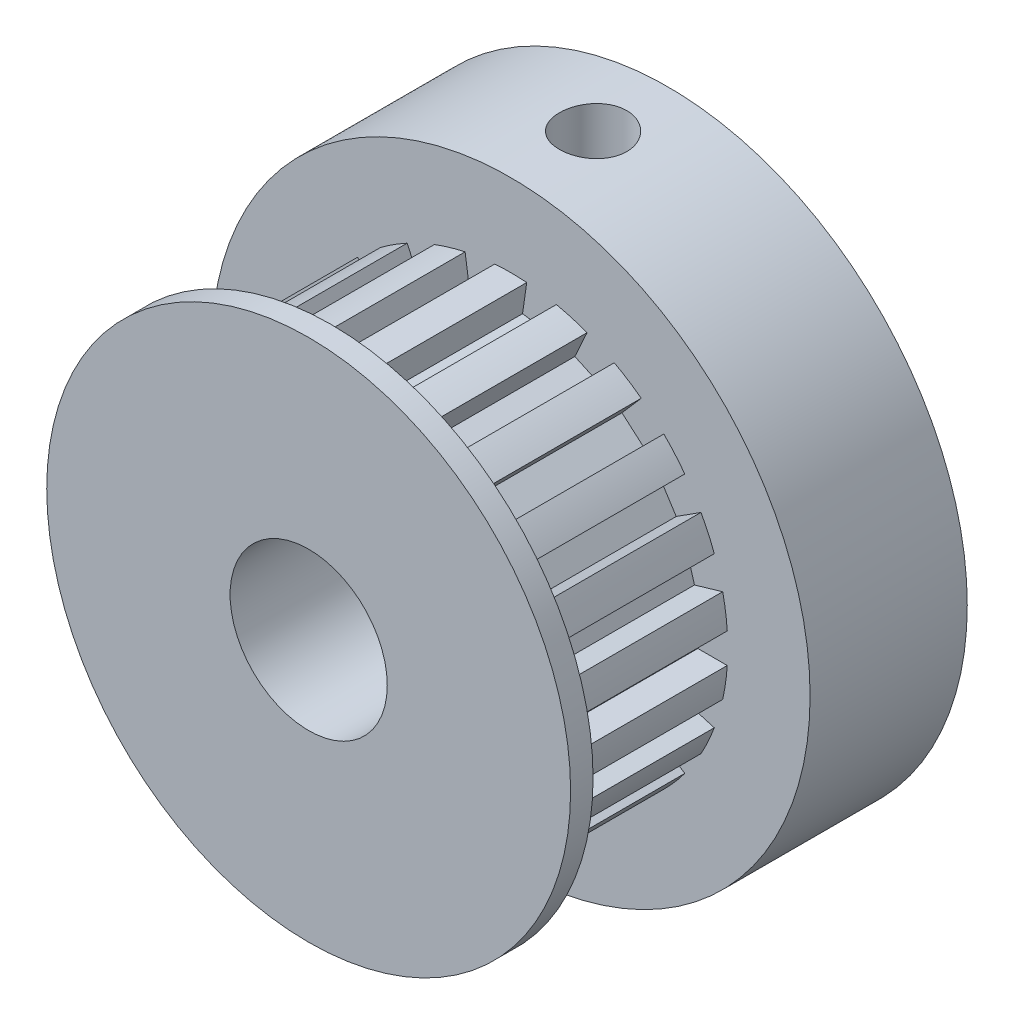
from build123d import *

# Parameters (mm, degrees)
SKETCH1_R               = 8.89
BOSS_EXTRUDE1_DEPTH     = 0.762
SKETCH2_R               = 7.366
BOSS_EXTRUDE2_DEPTH     = 6.096
SKETCH3_R               = 10.16
BOSS_EXTRUDE3_DEPTH     = 5.334
SKETCH4_R               = 2.667
CUT_EXTRUDE1_DEPTH      = 25.654
SKETCH5_W               = 6.096
SKETCH5_H               = 1.016
CUT_EXTRUDE2_DEPTH      = 1.016
CIRPATTERN1_COUNT       = 22
CUT_EXTRUDE3_DEPTH      = 22.098
CUT_EXTRUDE3_DEPTH_BACK = 22.098
SKETCH6_R               = 1.143


with BuildPart() as part:
    # Sketch1 → Boss-Extrude1 (new body)
    with BuildSketch(Plane.XY):
        Circle(SKETCH1_R)
    extrude(amount=-BOSS_EXTRUDE1_DEPTH)

    # Sketch2 → Boss-Extrude2 (add)
    with BuildSketch(Plane(origin=(0, 0, -0.762), x_dir=(-1, 0, 0), z_dir=(0, 0, -1))):
        Circle(SKETCH2_R)
    extrude(amount=BOSS_EXTRUDE2_DEPTH)

    # Sketch3 → Boss-Extrude3 (add)
    with BuildSketch(Plane(origin=(0, 0, -6.858), x_dir=(-1, 0, 0), z_dir=(0, 0, -1))):
        Circle(SKETCH3_R)
    extrude(amount=BOSS_EXTRUDE3_DEPTH)

    # Sketch4 → Cut-Extrude1 (cut)
    with BuildSketch(Plane.XY):
        Circle(SKETCH4_R)
    extrude(amount=-CUT_EXTRUDE1_DEPTH, mode=Mode.SUBTRACT)

    # Sketch5 → Cut-Extrude2 (cut)
    with BuildSketch(Plane.ZY.offset(7.366)):
        with Locations((-3.81, 0)):
            Rectangle(SKETCH5_W, SKETCH5_H)
    cut_extrude2 = extrude(amount=-CUT_EXTRUDE2_DEPTH, mode=Mode.SUBTRACT)

    # CirPattern1: Cut-Extrude2 ×22 about axis
    cirpattern1_axis = Axis((0, 0, -12.192), (0, 0, 1))
    for i in range(1, CIRPATTERN1_COUNT):
        add(cut_extrude2.rotate(cirpattern1_axis, i * 360 / CIRPATTERN1_COUNT), mode=Mode.SUBTRACT)

    # Sketch6 → Cut-Extrude3 (cut, two sides: drawn at the far end of the back side and taken through both)
    with BuildSketch(Plane(origin=(0, 0, 0), x_dir=(1, 0, 0), z_dir=(0, 1, 0)).offset(-CUT_EXTRUDE3_DEPTH_BACK)):
        with Locations((0, 9.652)):
            Circle(SKETCH6_R)
    extrude(amount=CUT_EXTRUDE3_DEPTH + CUT_EXTRUDE3_DEPTH_BACK, mode=Mode.SUBTRACT)


solid = part.part
